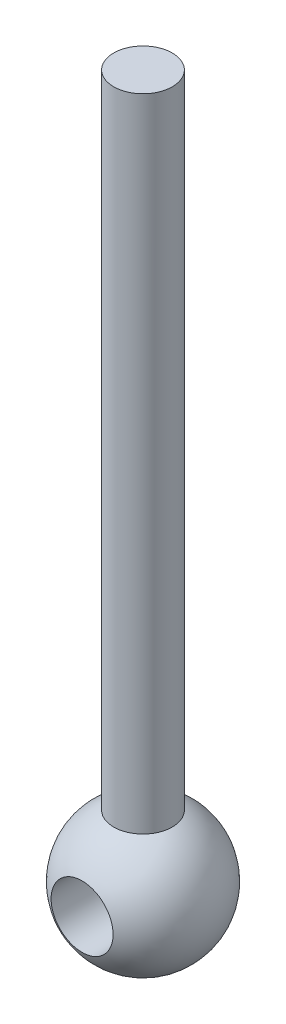
from build123d import *

# Parameters (mm, degrees)
BOSS_EXTRUDE1_START = 3.5
SKETCH2_R           = 3
BOSS_EXTRUDE1_DEPTH = 68.5


with BuildPart() as part:
    # Sketch1 → Revolve1 (revolve)
    with BuildSketch(Plane(origin=(0, 0, 0), x_dir=(1, 0, 0), z_dir=(0, 1, 0))):
        with BuildLine():
            Line((3.175, 6.238539493), (3.175, -6.238539493))
            ThreePointArc((3.175, -6.238539493), (7, 0), (3.175, 6.238539493))
        make_face()
    revolve(axis=Axis((0, 0, 6.238539493), (0, 0, -1)))

    # Sketch2 → Boss-Extrude1 (add)
    with BuildSketch(Plane(origin=(0, 0, 0), x_dir=(1, 0, 0), z_dir=(0, 1, 0)).offset(BOSS_EXTRUDE1_START)):
        Circle(SKETCH2_R)
    extrude(amount=BOSS_EXTRUDE1_DEPTH)


solid = part.part
